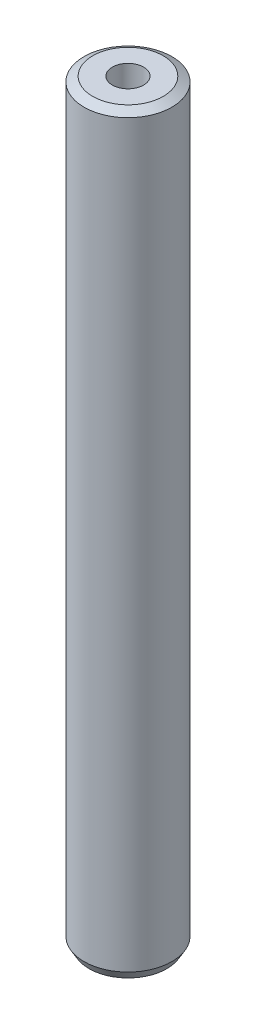
from build123d import *
from OCP.BRepFilletAPI import BRepFilletAPI_MakeChamfer

# Parameters (mm, degrees)
SKETCH1_R           = 5
BOSS_EXTRUDE1_DEPTH = 85.791856662
SKETCH2_R           = 1.779058611
CUT_EXTRUDE1_DEPTH  = 87.082766391
CHAMFER1_SIZE       = 0.569540559
CHAMFER1_SIZE2      = 0.986473185


with BuildPart() as part:
    # Sketch1 → Boss-Extrude1 (new body)
    with BuildSketch(Plane(origin=(0, 0, 0), x_dir=(1, 0, 0), z_dir=(0, 1, 0))):
        Circle(SKETCH1_R)
    extrude(amount=BOSS_EXTRUDE1_DEPTH)

    # Sketch2 → Cut-Extrude1 (cut, through all)
    with BuildSketch(Plane(origin=(0, 0, 0), x_dir=(1, 0, 0), z_dir=(0, 1, 0))):
        Circle(SKETCH2_R)
    extrude(amount=CUT_EXTRUDE1_DEPTH, mode=Mode.SUBTRACT)

    # Chamfer1: one chamfer whose edges measure the first distance from different faces: ONE call of the kernel's chamfer builder (chamfer() names one face for all edges)
    chamfer1_edges_1 = [part.edges().sort_by_distance(p)[0] for p in [
        (-5, 85.791856662, 0),
    ]]
    chamfer1_side_1 = [part.faces().sort_by_distance(p)[0] for p in [
        (-5, 42.895928331, 0),
    ]]
    chamfer1_edges_2 = [part.edges().sort_by_distance(p)[0] for p in [
        (-5, 0, 0),
    ]]
    chamfer1_side_2 = [part.faces().sort_by_distance(p)[0] for p in [
        (-4.858578644, 0, 0),
    ]]
    chamfer1 = BRepFilletAPI_MakeChamfer(part.part.solid().wrapped)
    for e in chamfer1_edges_1:
        chamfer1.Add(CHAMFER1_SIZE, CHAMFER1_SIZE2, e.wrapped, chamfer1_side_1[0].wrapped)  # the first distance lies on this face
    for e in chamfer1_edges_2:
        chamfer1.Add(CHAMFER1_SIZE, CHAMFER1_SIZE2, e.wrapped, chamfer1_side_2[0].wrapped)  # the first distance lies on this face
    add(Compound.cast(chamfer1.Shape()), mode=Mode.REPLACE)


solid = part.part
